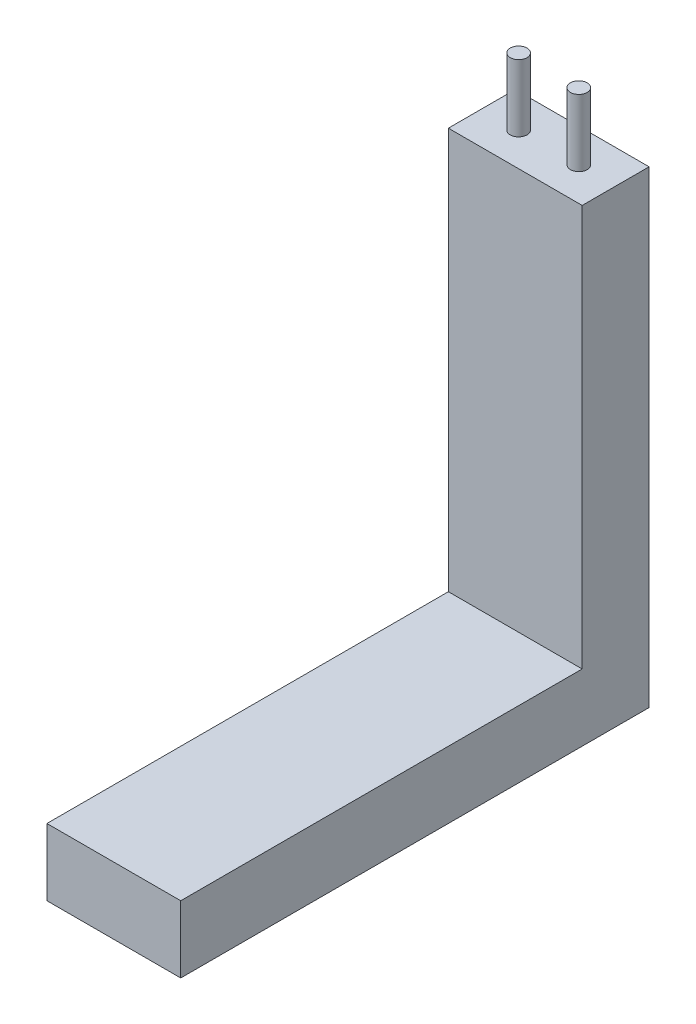
from build123d import *

# Parameters (mm, degrees)
SKETCH3_W           = 50.8
SKETCH3_H           = 25.4
BOSS_EXTRUDE1_DEPTH = 177.8
SKETCH5_W           = 50.8
SKETCH5_H           = 25.4
BOSS_EXTRUDE3_DEPTH = 152.4
SKETCH6_R           = 3.175
BOSS_EXTRUDE4_DEPTH = 25.4
SKETCH7_R           = 5.207
CUT_EXTRUDE1_DEPTH  = 17.78


with BuildPart() as part:
    # Sketch3 → Boss-Extrude1 (new body)
    with BuildSketch(Plane(origin=(0, 0, 0), x_dir=(1, 0, 0), z_dir=(0, 1, 0))):
        with Locations((0, 12.7)):
            Rectangle(SKETCH3_W, SKETCH3_H)
    extrude(amount=BOSS_EXTRUDE1_DEPTH)

    # Sketch5 → Boss-Extrude3 (add)
    with BuildSketch(Plane.XY):
        with Locations((0, 12.7)):
            Rectangle(SKETCH5_W, SKETCH5_H)
    extrude(amount=BOSS_EXTRUDE3_DEPTH)

    # Sketch6 → Boss-Extrude4 (add)
    with BuildSketch(Plane(origin=(0, 177.8, 0), x_dir=(1, 0, 0), z_dir=(0, 1, 0))):
        with Locations((-11.43, 12.7)):
            Circle(SKETCH6_R)
        with Locations((11.43, 12.7)):
            Circle(SKETCH6_R)
    extrude(amount=BOSS_EXTRUDE4_DEPTH)

    # Sketch7 → Cut-Extrude1 (cut)
    with BuildSketch(Plane(origin=(0, 0, 0), x_dir=(-1, 0, 0), z_dir=(0, -1, 0))):
        with Locations((-11.43, 12.7)):
            Circle(SKETCH7_R)
        with Locations((11.43, 12.7)):
            Circle(SKETCH7_R)
    extrude(amount=-CUT_EXTRUDE1_DEPTH, mode=Mode.SUBTRACT)


solid = part.part
